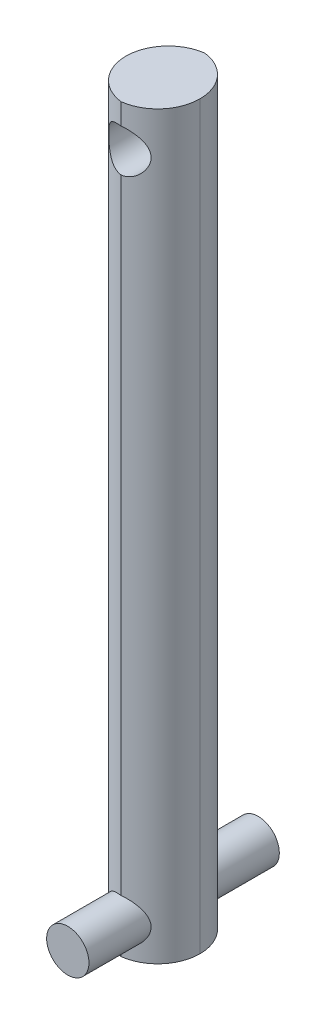
from build123d import *

# Parameters (mm, degrees)
SKETCH2_W           = 7
SKETCH2_H           = 8
BOSS_EXTRUDE1_DEPTH = 70
SKETCH3_R           = 2
BOSS_EXTRUDE2_DEPTH = 5
CUT_EXTRUDE1_REACH  = 73.283
SKETCH4_R           = 2
FILLET1_R           = 4


with BuildPart() as part:
    # Sketch2 → Boss-Extrude1 (new body)
    with BuildSketch(Plane(origin=(0, 0, 0), x_dir=(1, 0, 0), z_dir=(0, 1, 0))):
        Rectangle(SKETCH2_W, SKETCH2_H)
    extrude(amount=BOSS_EXTRUDE1_DEPTH)

    # Sketch3 → Boss-Extrude2 (add)
    with BuildSketch(Plane.XY.offset(4)):
        with Locations(Location((0, 3, 0), (0, 0, 180))):
            Circle(SKETCH3_R)
    boss_extrude2 = extrude(amount=BOSS_EXTRUDE2_DEPTH)

    # Mirror1: Boss-Extrude2 across plane
    add(boss_extrude2.mirror(Plane.XY))

    # Sketch4 → Cut-Extrude1 (cut, up to next)
    with BuildSketch(Plane.XY.offset(4), mode=Mode.PRIVATE) as cut_extrude1_sk1:
        with Locations((0, 66)):
            Circle(SKETCH4_R)
    cut_extrude1_tool1 = extrude(cut_extrude1_sk1.sketch, amount=-CUT_EXTRUDE1_REACH, mode=Mode.PRIVATE) & part.part
    add(cut_extrude1_tool1.solids().sort_by_distance((0, 66, 4))[0], mode=Mode.SUBTRACT)

    # Fillet1
    # the kernel refuses this fillet: 4 mm, written as the material it takes off along each edge
    with BuildSketch(Plane(origin=(-3.5, -10, 4), x_dir=(0, 0, -1), z_dir=(0, 1, 0))) as fillet1_piece_1_section:
        with BuildLine():
            CenterArc((FILLET1_R, -FILLET1_R), FILLET1_R, 90, 90)
            Line((0, -FILLET1_R), (0, 0))
            Line((0, 0), (FILLET1_R, 0))
        make_face()
    fillet1_piece_1 = extrude(amount=90, mode=Mode.PRIVATE)
    fillet1_piece_1 = fillet1_piece_1 - Plane(origin=(0, 3, 3.08936477), x_dir=(-1, 0, 0), z_dir=(0, 0, -1)) * Cylinder(2, 196, mode=Mode.PRIVATE)
    add(fillet1_piece_1, mode=Mode.SUBTRACT)
    with BuildSketch(Plane(origin=(-3.5, -10, -4), x_dir=(1, 0, 0), z_dir=(0, 1, 0))) as fillet1_piece_2_section:
        with BuildLine():
            CenterArc((FILLET1_R, -FILLET1_R), FILLET1_R, 90, 90)
            Line((0, -FILLET1_R), (0, 0))
            Line((0, 0), (FILLET1_R, 0))
        make_face()
    fillet1_piece_2 = extrude(amount=90, mode=Mode.PRIVATE)
    fillet1_piece_2 = fillet1_piece_2 - Plane(origin=(0, 3, -3.089364757), x_dir=(-1, 0, 0), z_dir=(0, 0, 1)) * Cylinder(2, 196, mode=Mode.PRIVATE)
    add(fillet1_piece_2, mode=Mode.SUBTRACT)
    with BuildSketch(Plane(origin=(3.5, -10, -4), x_dir=(-1, 0, 0), z_dir=(0, 1, 0))) as fillet1_piece_3_section:
        with BuildLine():
            CenterArc((FILLET1_R, FILLET1_R), FILLET1_R, 180, 90)
            Line((0, FILLET1_R), (0, 0))
            Line((0, 0), (FILLET1_R, 0))
        make_face()
    fillet1_piece_3 = extrude(amount=90, mode=Mode.PRIVATE)
    fillet1_piece_3 = fillet1_piece_3 - Plane(origin=(0, 3, -3.089364802), x_dir=(-1, 0, 0), z_dir=(0, 0, 1)) * Cylinder(2, 196, mode=Mode.PRIVATE)
    add(fillet1_piece_3, mode=Mode.SUBTRACT)
    with BuildSketch(Plane(origin=(3.5, -10, 4), x_dir=(0, 0, -1), z_dir=(0, 1, 0))) as fillet1_piece_4_section:
        with BuildLine():
            CenterArc((FILLET1_R, FILLET1_R), FILLET1_R, 180, 90)
            Line((0, FILLET1_R), (0, 0))
            Line((0, 0), (FILLET1_R, 0))
        make_face()
    fillet1_piece_4 = extrude(amount=90, mode=Mode.PRIVATE)
    fillet1_piece_4 = fillet1_piece_4 - Plane(origin=(0, 3, 3.089364961), x_dir=(-1, 0, 0), z_dir=(0, 0, -1)) * Cylinder(2, 196, mode=Mode.PRIVATE)
    add(fillet1_piece_4, mode=Mode.SUBTRACT)


solid = part.part
